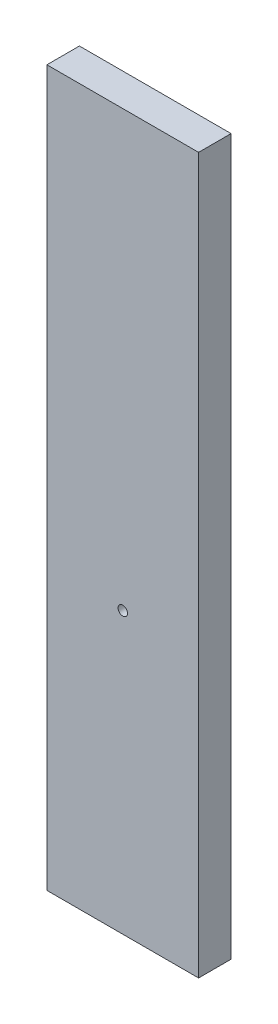
from build123d import *

# Parameters (mm, degrees)
SKETCH1_W           = 88.9
SKETCH1_H           = 19.05
BOSS_EXTRUDE1_DEPTH = 419.1
SKETCH2_R           = 2.778125
CUT_EXTRUDE1_DEPTH  = 429.848367725


with BuildPart() as part:
    # Sketch1 → Boss-Extrude1 (new body)
    with BuildSketch(Plane(origin=(0, 0, 0), x_dir=(1, 0, 0), z_dir=(0, 1, 0))):
        with Locations((44.45, 9.525)):
            Rectangle(SKETCH1_W, SKETCH1_H)
    extrude(amount=BOSS_EXTRUDE1_DEPTH)

    # Sketch2 → Cut-Extrude1 (cut, through all)
    with BuildSketch(Plane.XY):
        with Locations((44.45, 164.277578123)):
            Circle(SKETCH2_R)
    extrude(amount=-CUT_EXTRUDE1_DEPTH, mode=Mode.SUBTRACT)


solid = part.part
